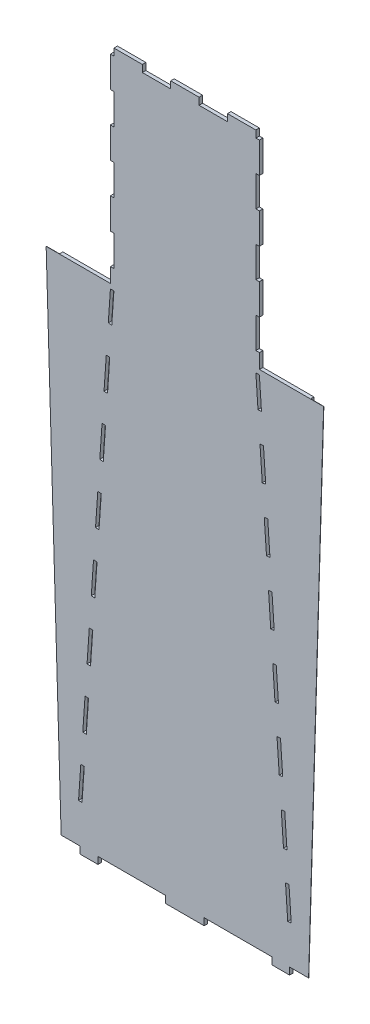
from build123d import *

# Parameters (mm, degrees)
BOSS_EXTRUDE1_DEPTH = 10.16
CUT_LOFT1_DEPTH     = 9.5


# Read off the part's stored shape, not the designer's step: Cut-Loft1
with BuildPart() as part:
    # Sketch1 → Boss-Extrude1 (new body)
    # profile 1 of 2: a face of its own
    with BuildSketch(Plane.XY):
        Polygon((205.715298803, 2072.64), (123.444, 2072.64), (123.444, 2052.32), (41.135649402, 2052.32), (41.135649402, 2072.64), (-41.135649402, 2072.64), (-41.135649402, 2052.32), (-123.444, 2052.32), (-123.444, 2072.64), (-205.715298803, 2072.64), (-205.715298803, 2052.32), (-215.881789204, 2052.32), (-215.881789204, 1963.42), (-205.715298803, 1963.42), (-205.715298803, 1874.52), (-215.881789204, 1874.52), (-215.881789204, 1785.62), (-205.715298803, 1785.62), (-205.715298803, 1696.72), (-215.875298803, 1696.72), (-215.875298803, 1607.82), (-205.715298803, 1607.82), (-205.715298803, 1518.92), (205.715298803, 1518.92), (205.715298803, 1607.82), (215.875298803, 1607.82), (215.875298803, 1696.72), (205.715298803, 1696.72), (205.715298803, 1785.62), (215.881789204, 1785.62), (215.881789204, 1874.52), (205.715298803, 1874.52), (205.715298803, 1963.42), (215.881789204, 1963.42), (215.881789204, 2052.32), (205.715298803, 2052.32), align=None)
    # profile 2 of 2: a face of its own
    with BuildSketch(Plane.XY):
        Polygon((215.881789204, 1518.92), (205.715298803, 1518.92), (-205.715298803, 1518.92), (-215.881789204, 1518.92), (-215.881789204, 1476.636861244), (-402.149872815, 1476.636861244), (-358.672996954, 20.32), (-303.52, 20.32), (-303.52, 0), (-252, 0), (-252, 20.32), (-55.8292, 20.32), (-55.8292, 0), (55.8292, 0), (55.8292, 20.32), (252, 20.32), (252, 0), (303.52, 0), (303.52, 20.32), (358.672996954, 20.32), (402.149872815, 1476.636861244), (215.881789204, 1476.636861244), align=None)
        Polygon((-308.266124544, 132.94397688), (-301.755453134, 226.680843836), (-291.63777305, 225.978101227), (-298.14844446, 132.241234271), align=None, mode=Mode.SUBTRACT)
        Polygon((-289.435698895, 404.053512688), (-279.318018811, 403.350770078), (-285.830533081, 309.587370692), (-295.948213166, 310.290113301), align=None, mode=Mode.SUBTRACT)
        Polygon((-283.630301787, 487.636249721), (-277.115944656, 581.426181539), (-266.998264572, 580.72343893), (-273.512621703, 486.933507112), align=None, mode=Mode.SUBTRACT)
        Polygon((-264.796190418, 758.798850391), (-254.678510334, 758.096107781), (-261.194710324, 664.279643533), (-271.312390408, 664.982386142), align=None, mode=Mode.SUBTRACT)
        Polygon((-252.476436179, 936.171519242), (-242.358756095, 935.468776633), (-248.876798945, 841.625779953), (-258.99447903, 842.328522563), align=None, mode=Mode.SUBTRACT)
        Polygon((301.755453134, 226.680843836), (308.266124544, 132.94397688), (298.14844446, 132.241234271), (291.63777305, 225.978101227), align=None, mode=Mode.SUBTRACT)
        Polygon((279.318018811, 403.350770078), (289.435698895, 404.053512688), (295.948213166, 310.290113301), (285.830533081, 309.587370692), align=None, mode=Mode.SUBTRACT)
        Polygon((277.115944656, 581.426181539), (283.630301787, 487.636249721), (273.512621703, 486.933507112), (266.998264572, 580.72343893), align=None, mode=Mode.SUBTRACT)
        Polygon((254.678510334, 758.096107781), (264.796190418, 758.798850391), (271.312390408, 664.982386142), (261.194710324, 664.279643533), align=None, mode=Mode.SUBTRACT)
        Polygon((242.358756095, 935.468776633), (252.476436179, 936.171519242), (258.99447903, 842.328522563), (248.876798945, 841.625779953), align=None, mode=Mode.SUBTRACT)
        Polygon((-240.15668194, 1113.544188093), (-230.039001856, 1112.841445484), (-236.558887567, 1018.971916374), (-246.676567651, 1019.674658983), align=None, mode=Mode.SUBTRACT)
        Polygon((-227.836927701, 1290.916856945), (-217.719247617, 1290.214114336), (-224.240976188, 1196.318052795), (-234.358656272, 1197.020795404), align=None, mode=Mode.SUBTRACT)
        Polygon((-215.881789204, 1463.040000035), (-214.479068593, 1463.040000035), (-205.715298803, 1463.040000035), (-211.92306481, 1373.664189215), (-222.040744894, 1374.366931824), align=None, mode=Mode.SUBTRACT)
        Polygon((230.039001856, 1112.841445484), (240.15668194, 1113.544188093), (246.676567651, 1019.674658983), (236.558887567, 1018.971916374), align=None, mode=Mode.SUBTRACT)
        Polygon((217.719247617, 1290.214114336), (227.836927701, 1290.916856945), (234.358656272, 1197.020795404), (224.240976188, 1196.318052795), align=None, mode=Mode.SUBTRACT)
        Polygon((205.715298803, 1463.040000035), (215.881789204, 1463.040000035), (222.040744894, 1374.366931824), (211.92306481, 1373.664189215), align=None, mode=Mode.SUBTRACT)
    extrude(amount=BOSS_EXTRUDE1_DEPTH)

    # Cut-Loft1 outline → Cut-Loft1 (cut)
    with BuildSketch(Plane.XY):
        Polygon((402.149872815, 1476.636861244), (364.049872815, 1476.636861244), (320.627659668, 20.32), (358.672996954, 20.32), align=None)
    cut_loft1 = extrude(amount=CUT_LOFT1_DEPTH, mode=Mode.SUBTRACT)

    # Mirror1: Cut-Loft1 across plane
    add(cut_loft1.mirror(Plane(origin=(0, 0, 0), x_dir=(0, 0, 1), z_dir=(1, 0, 0))), mode=Mode.SUBTRACT)


solid = part.part
